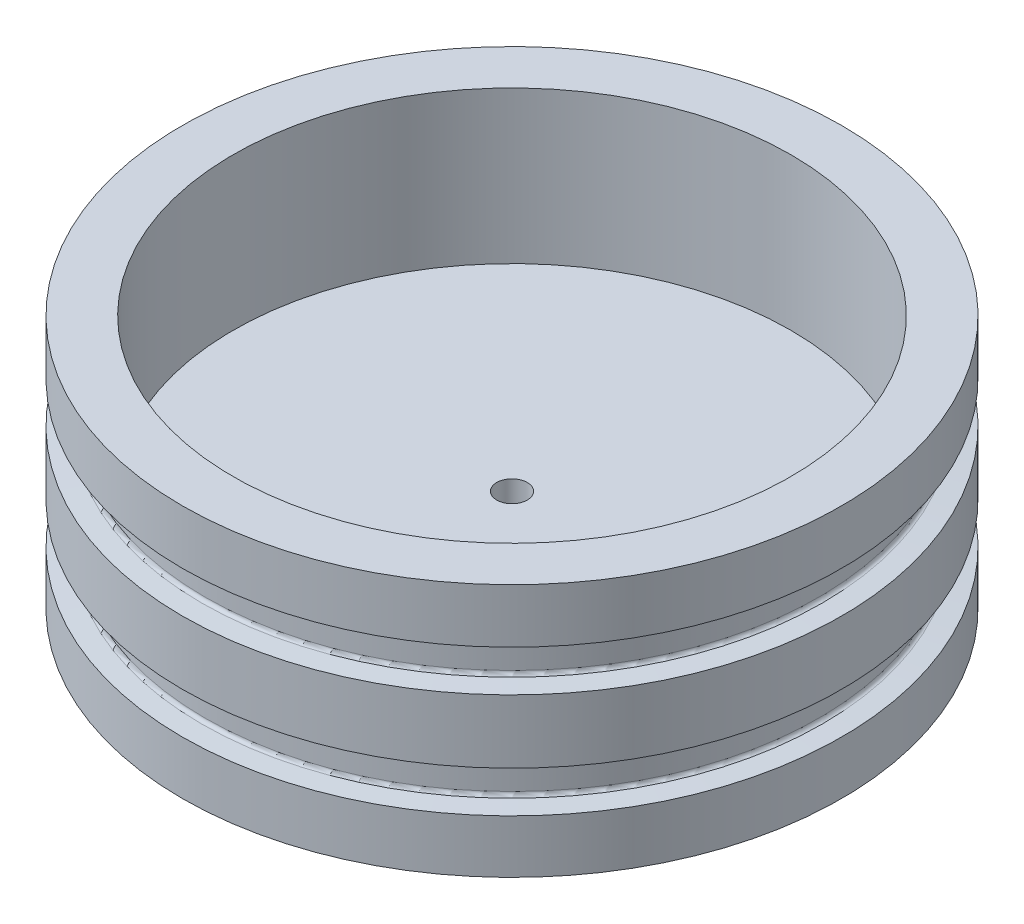
from build123d import *

# Parameters (mm, degrees)
LPATTERN1_COUNT = 2
LPATTERN1_PITCH = 13.123333333


with BuildPart() as part:
    # Sketch1 → Revolve1 (revolve)
    with BuildSketch(Plane.XY):
        Polygon((-41.275, 11.176), (-41.275, 42.926), (-34.925, 42.926), (-34.925, 23.876), (-1.91325754, 23.876), (-1.91325754, 0), (-5.1435, 0), (-5.1435, 11.176), align=None)
    revolve(axis=Axis((0, 0, 0), (0, 1, 0)))

    # Sketch3 → Groove for AS 568-234, O-Ring1 (revolve, cut)
    with BuildSketch(Plane(origin=(0, 0, 0), x_dir=(0, 0, -1), z_dir=(-1, 0, 0))):
        with BuildLine():
            Line((38.861359272, -31.183922723), (41.3639, -30.964978779))
            Line((41.3639, -30.964978779), (41.3639, -36.152666667))
            Line((41.3639, -36.152666667), (38.861359272, -35.933722723))
            ThreePointArc((38.861359272, -35.933722723), (38.572380224, -35.791214027), (38.4556, -35.49091418))
            Line((38.4556, -35.49091418), (38.4556, -31.626731266))
            ThreePointArc((38.4556, -31.626731266), (38.572380224, -31.326431419), (38.861359272, -31.183922723))
        make_face()
    groove_for_as_568_234_o_ring1 = revolve(axis=Axis((0, -50, 0), (0, 1, 0)), mode=Mode.SUBTRACT)

    # LPattern1: Groove for AS 568-234, O-Ring1 ×2
    with Locations(*[(0, -i * LPATTERN1_PITCH, 0) for i in range(1, LPATTERN1_COUNT)]):
        add(groove_for_as_568_234_o_ring1, mode=Mode.SUBTRACT)


solid = part.part
